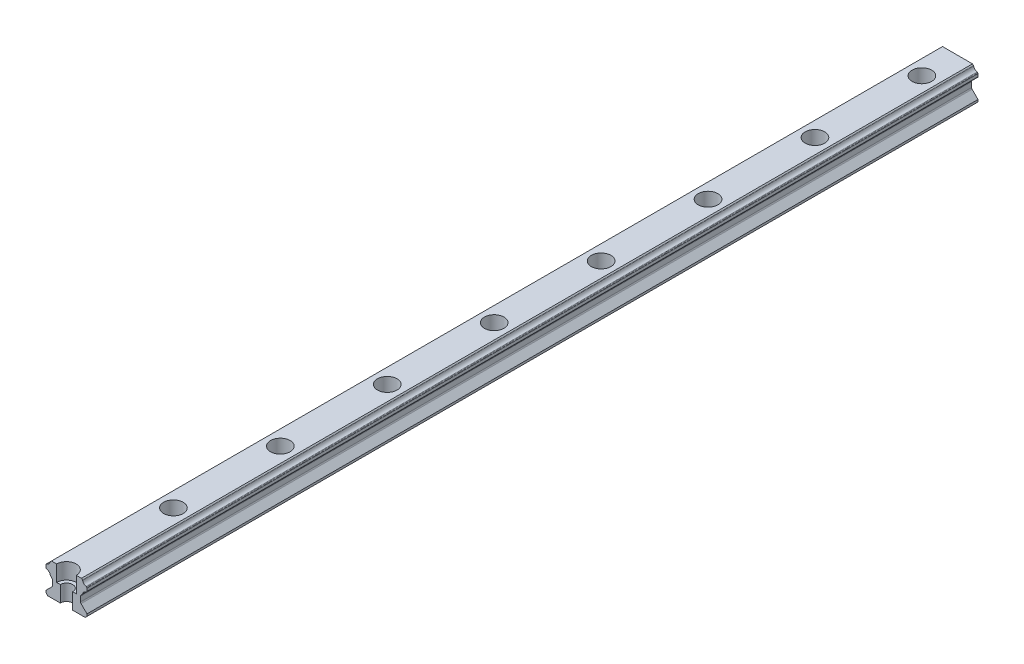
from build123d import *

# Parameters (mm, degrees)
BOSS_EXTRUDE1_DEPTH                                 = 500
CBORE_FOR_M6_HEX_SOCKET_HEAD_CAP_SCREW1_D           = 7
CBORE_FOR_M6_HEX_SOCKET_HEAD_CAP_SCREW1_CBORE_D     = 11
CBORE_FOR_M6_HEX_SOCKET_HEAD_CAP_SCREW1_CBORE_DEPTH = 9
LPATTERN1_COUNT                                     = 9
LPATTERN1_PITCH                                     = 60


with BuildPart() as part:
    # Sketch1 → Boss-Extrude1 (new body)
    with BuildSketch(Plane.XY):
        with BuildLine():
            Line((-8.192893219, -12.452822372), (-11.5, -15.759929153))
            Line((-11.5, -15.759929153), (-11.5, -17))
            Line((-11.5, -17), (-10.5, -18))
            Line((-10.5, -18), (10.5, -18))
            Line((10.5, -18), (11.5, -17))
            Line((11.5, -17), (11.5, -15.759929153))
            Line((11.5, -15.759929153), (8.192893219, -12.452822372))
            ThreePointArc((8.192893219, -12.452822372), (7.976120468, -12.128399023), (7.9, -11.745715591))
            Line((7.9, -11.745715591), (7.9, -8.934076562))
            ThreePointArc((7.9, -8.934076562), (7.976120468, -8.55139313), (8.192893219, -8.226969781))
            Line((8.192893219, -8.226969781), (8.93515621, -7.48470679))
            ThreePointArc((8.93515621, -7.48470679), (9.020912002, -7.369915712), (9.070589884, -7.235516473))
            ThreePointArc((9.070589884, -7.235516473), (9.728797536, -6.024451536), (10.939862473, -5.366243884))
            ThreePointArc((10.939862473, -5.366243884), (11.074261712, -5.316566002), (11.18905279, -5.23081021))
            Line((11.18905279, -5.23081021), (11.353553391, -5.066309609))
            ThreePointArc((11.353553391, -5.066309609), (11.461939766, -4.904097935), (11.5, -4.712756219))
            Line((11.5, -4.712756219), (11.5, -3.298408781))
            ThreePointArc((11.5, -3.298408781), (11.461939766, -3.107067065), (11.353553391, -2.944855391))
            Line((11.353553391, -2.944855391), (11.175123458, -2.766425458))
            ThreePointArc((11.175123458, -2.766425458), (11.061399997, -2.681251593), (10.928310161, -2.631505152))
            ThreePointArc((10.928310161, -2.631505152), (9.728797536, -1.975792464), (9.073084848, -0.776279839))
            ThreePointArc((9.073084848, -0.776279839), (9.023338407, -0.643190003), (8.938164542, -0.529466542))
            Line((8.938164542, -0.529466542), (8.408698, 0))
            Line((8.408698, 0), (-8.408698, 0))
            Line((-8.408698, 0), (-8.938164542, -0.529466542))
            ThreePointArc((-8.938164542, -0.529466542), (-9.023338407, -0.643190003), (-9.073084848, -0.776279839))
            ThreePointArc((-9.073084848, -0.776279839), (-9.728797536, -1.975792464), (-10.928310161, -2.631505152))
            ThreePointArc((-10.928310161, -2.631505152), (-11.061399997, -2.681251593), (-11.175123458, -2.766425458))
            Line((-11.175123458, -2.766425458), (-11.353553391, -2.944855391))
            ThreePointArc((-11.353553391, -2.944855391), (-11.461939766, -3.107067065), (-11.5, -3.298408781))
            Line((-11.5, -3.298408781), (-11.5, -4.712756219))
            ThreePointArc((-11.5, -4.712756219), (-11.461939766, -4.904097935), (-11.353553391, -5.066309609))
            Line((-11.353553391, -5.066309609), (-11.18905279, -5.23081021))
            ThreePointArc((-11.18905279, -5.23081021), (-11.074261712, -5.316566002), (-10.939862473, -5.366243884))
            ThreePointArc((-10.939862473, -5.366243884), (-9.728797536, -6.024451536), (-9.070589884, -7.235516473))
            ThreePointArc((-9.070589884, -7.235516473), (-9.020912002, -7.369915712), (-8.93515621, -7.48470679))
            Line((-8.93515621, -7.48470679), (-8.192893219, -8.226969781))
            ThreePointArc((-8.192893219, -8.226969781), (-7.976120468, -8.55139313), (-7.9, -8.934076562))
            Line((-7.9, -8.934076562), (-7.9, -11.745715591))
            ThreePointArc((-7.9, -11.745715591), (-7.976120468, -12.128399023), (-8.192893219, -12.452822372))
        make_face()
    extrude(amount=BOSS_EXTRUDE1_DEPTH)

    # CBORE for M6 Hex Socket Head Cap Screw1 (through all)
    with Locations(Plane(origin=(0, 0, 20), x_dir=(0, 0, 1), z_dir=(0, 1, 0))):
        with Locations((0, 0)):
            cbore_for_m6_hex_socket_head_cap_screw1 = CounterBoreHole(CBORE_FOR_M6_HEX_SOCKET_HEAD_CAP_SCREW1_D / 2, CBORE_FOR_M6_HEX_SOCKET_HEAD_CAP_SCREW1_CBORE_D / 2, CBORE_FOR_M6_HEX_SOCKET_HEAD_CAP_SCREW1_CBORE_DEPTH)

    # LPattern1: CBORE for M6 Hex Socket Head Cap Screw1 ×9
    with Locations(*[(0, 0, i * LPATTERN1_PITCH) for i in range(1, LPATTERN1_COUNT)]):
        add(cbore_for_m6_hex_socket_head_cap_screw1, mode=Mode.SUBTRACT)


solid = part.part
